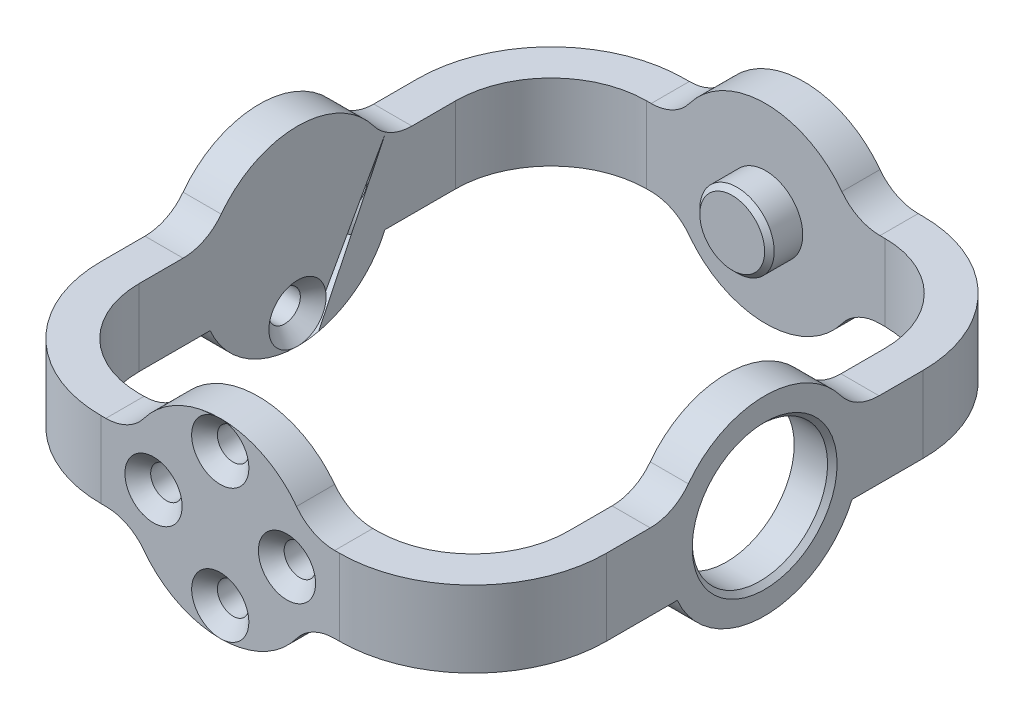
from build123d import *

# Parameters (mm, degrees)
BOSS_EXTRUDE1_DEPTH      = 4
BOSS_EXTRUDE1_DEPTH_BACK = 4
SKETCH4_W                = 53
SKETCH4_H                = 61.2
SKETCH4_W_2              = 45
SKETCH4_H_2              = 53.2
SKETCH5_R                = 10
BOSS_EXTRUDE2_DEPTH      = 4
BOSS_EXTRUDE3_START      = -4
SKETCH6_R                = 10
BOSS_EXTRUDE3_DEPTH      = 4
SKETCH7_R                = 1.65
CUT_EXTRUDE1_DEPTH       = 4
CHAMFER1_SIZE            = 1.35
SKETCH8_R                = 3.9
BOSS_EXTRUDE4_DEPTH      = 3.5
FILLET1_R                = 10
FILLET2_R                = 14
FILLET3_R                = 5
CHAMFER2_SIZE            = 0.5
SKETCH9_R                = 10
BOSS_EXTRUDE5_DEPTH      = 4
BOSS_EXTRUDE6_START      = -4
SKETCH10_R               = 10
BOSS_EXTRUDE6_DEPTH      = 4
SKETCH11_R               = 7.1
CUT_EXTRUDE2_DEPTH       = 4
SKETCH12_R               = 1.65
CUT_EXTRUDE3_DEPTH       = 4
CHAMFER3_SIZE            = 1.35
FILLET4_R                = 5
CHAMFER4_SIZE            = 0.5


with BuildPart() as part:
    # Sketch4 → Boss-Extrude1 (new, two sides: drawn at the far end of the back side and taken through both)
    with BuildSketch(Plane(origin=(0, 0, 0), x_dir=(1, 0, 0), z_dir=(0, 1, 0)).offset(-BOSS_EXTRUDE1_DEPTH_BACK)):
        Rectangle(SKETCH4_W, SKETCH4_H)
        Rectangle(SKETCH4_W_2, SKETCH4_H_2, mode=Mode.SUBTRACT)
    extrude(amount=BOSS_EXTRUDE1_DEPTH + BOSS_EXTRUDE1_DEPTH_BACK)

    # Sketch5 → Boss-Extrude2 (add)
    with BuildSketch(Plane.XY.offset(30.6)):
        Circle(SKETCH5_R)
    extrude(amount=-BOSS_EXTRUDE2_DEPTH)

    # Sketch6 → Boss-Extrude3 (add)
    with BuildSketch(Plane(origin=(0, 0, -30.6), x_dir=(-1, 0, 0), z_dir=(0, 0, -1)).offset(BOSS_EXTRUDE3_START)):
        Circle(SKETCH6_R)
    extrude(amount=BOSS_EXTRUDE3_DEPTH)

    # Sketch7 → Cut-Extrude1 (cut)
    with BuildSketch(Plane.XY.offset(30.6)):
        with Locations((0, 7)):
            Circle(SKETCH7_R)
        with Locations((7, 0)):
            Circle(SKETCH7_R)
        with Locations((0, -7)):
            Circle(SKETCH7_R)
        with Locations((-7, 0)):
            Circle(SKETCH7_R)
    extrude(amount=-CUT_EXTRUDE1_DEPTH, mode=Mode.SUBTRACT)

    # Chamfer1
    chamfer1_edges = [part.edges().sort_by_distance(p)[0] for p in [
        (-1.65, 7, 30.6),
        (5.35, 0, 30.6),
        (-1.65, -7, 30.6),
        (-8.65, 0, 30.6),
    ]]
    chamfer(chamfer1_edges, length=CHAMFER1_SIZE - 0.0001)  # a hair under: the kernel refuses the full size

    # Sketch8 → Boss-Extrude4 (add)
    with BuildSketch(Plane.XY.offset(-26.6)):
        with Locations(Location((0, 0, 0), (0, 0, 180))):
            Circle(SKETCH8_R)
    extrude(amount=BOSS_EXTRUDE4_DEPTH)

    # Fillet1
    fillet1_edges = [part.edges().sort_by_distance(p)[0] for p in [
        (-22.5, 0, 26.6),
        (-22.5, 0, -26.6),
        (22.5, 0, -26.6),
        (22.5, 0, 26.6),
    ]]
    fillet(fillet1_edges, radius=FILLET1_R)

    # Fillet2
    fillet2_edges = [part.edges().sort_by_distance(p)[0] for p in [
        (-26.5, 0, 30.6),
        (-26.5, 0, -30.6),
        (26.5, 0, -30.6),
        (26.5, 0, 30.6),
    ]]
    fillet(fillet2_edges, radius=FILLET2_R)

    # Fillet3
    fillet3_edges = [part.edges().sort_by_distance(p)[0] for p in [
        (-9.16515139, 4, 28.6),
        (9.16515139, 4, 28.6),
        (9.16515139, -4, 28.6),
        (-9.16515139, -4, 28.6),
        (9.16515139, 4, -28.6),
        (-9.16515139, 4, -28.6),
        (-9.16515139, -4, -28.6),
        (9.16515139, -4, -28.6),
    ]]
    fillet(fillet3_edges, radius=FILLET3_R)

    # Chamfer2
    chamfer2_edges = [part.edges().sort_by_distance(p)[0] for p in [
        (3.9, 0, -23.1),
    ]]
    chamfer(chamfer2_edges, length=CHAMFER2_SIZE)

    # Sketch9 → Boss-Extrude5 (add)
    with BuildSketch(Plane.ZY.offset(26.5)):
        Circle(SKETCH9_R)
    extrude(amount=-BOSS_EXTRUDE5_DEPTH)

    # Sketch10 → Boss-Extrude6 (add)
    with BuildSketch(Plane(origin=(26.5, 0, 0), x_dir=(0, 0, -1), z_dir=(1, 0, 0)).offset(BOSS_EXTRUDE6_START)):
        Circle(SKETCH10_R)
    extrude(amount=BOSS_EXTRUDE6_DEPTH)

    # Sketch11 → Cut-Extrude2 (cut)
    with BuildSketch(Plane(origin=(26.5, 0, 0), x_dir=(0, 0, -1), z_dir=(1, 0, 0))):
        Circle(SKETCH11_R)
    extrude(amount=-CUT_EXTRUDE2_DEPTH, mode=Mode.SUBTRACT)

    # Sketch12 → Cut-Extrude3 (cut)
    with BuildSketch(Plane.ZY.offset(26.5)):
        with Locations((0, 7)):
            Circle(SKETCH12_R)
        with Locations((7, 0)):
            Circle(SKETCH12_R)
        with Locations((0, -7)):
            Circle(SKETCH12_R)
        with Locations((-7, 0)):
            Circle(SKETCH12_R)
    extrude(amount=-CUT_EXTRUDE3_DEPTH, mode=Mode.SUBTRACT)

    # Chamfer3
    chamfer3_edges = [part.edges().sort_by_distance(p)[0] for p in [
        (-22.5, 7, -1.65),
        (-22.5, 0, 5.35),
        (-22.5, -7, -1.65),
        (-22.5, 0, -8.65),
    ]]
    chamfer(chamfer3_edges, length=CHAMFER3_SIZE - 0.0001)  # a hair under: the kernel refuses the full size

    # Fillet4
    fillet4_edges = [part.edges().sort_by_distance(p)[0] for p in [
        (-24.5, 4, 9.16515139),
        (-24.5, 4, -9.16515139),
        (24.5, 4, 9.16515139),
        (24.5, 4, -9.16515139),
    ]]
    fillet(fillet4_edges, radius=FILLET4_R)

    # Chamfer4
    chamfer4_edges = [part.edges().sort_by_distance(p)[0] for p in [
        (26.5, 0, 7.1),
    ]]
    chamfer(chamfer4_edges, length=CHAMFER4_SIZE)


solid = part.part
